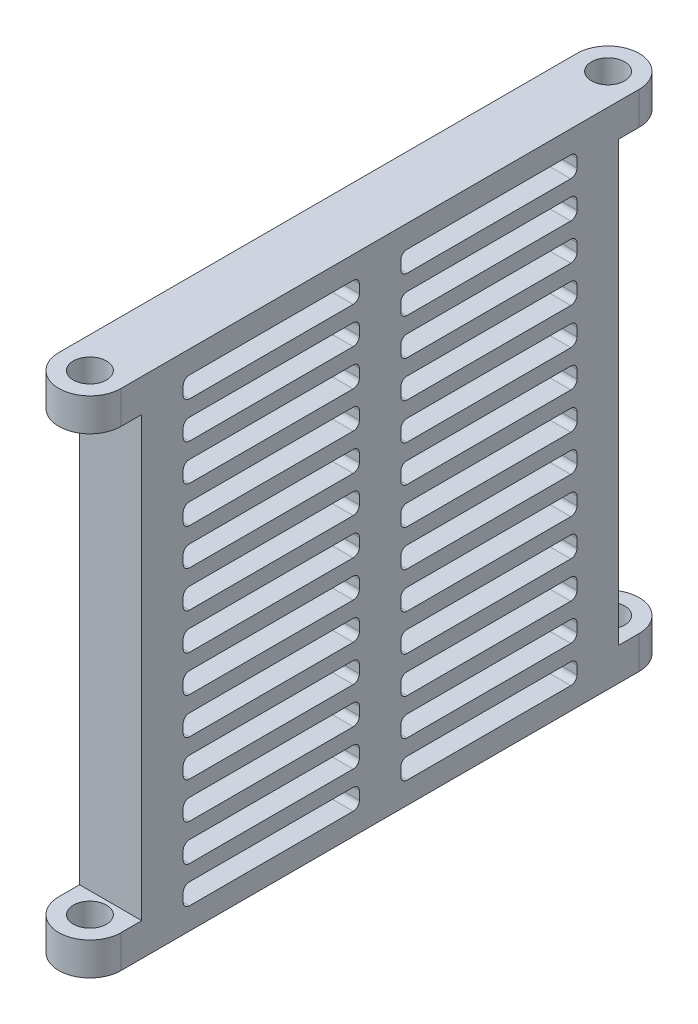
from build123d import *

# Parameters (mm, degrees)
SKETCH2_R           = 1.6
BOSS_EXTRUDE1_DEPTH = 3.175
SKETCH3_W           = 6
SKETCH3_H           = 46
BOSS_EXTRUDE2_DEPTH = 42.3
CUT_EXTRUDE1_DEPTH  = 73.192953257


with BuildPart() as part:
    # Sketch2 → Boss-Extrude1 (new body)
    with BuildSketch(Plane(origin=(0, 0, 0), x_dir=(1, 0, 0), z_dir=(0, 1, 0))):
        with BuildLine():
            Line((-3, 0), (-3, -50))
            ThreePointArc((-3, -50), (0, -53), (3, -50))
            Line((3, -50), (3, 0))
            ThreePointArc((3, 0), (0, 3), (-3, 0))
        make_face()
        Circle(SKETCH2_R, mode=Mode.SUBTRACT)
        with Locations((0, -50)):
            Circle(SKETCH2_R, mode=Mode.SUBTRACT)
    boss_extrude1 = extrude(amount=BOSS_EXTRUDE1_DEPTH)

    # Sketch3 → Boss-Extrude2 (add)
    with BuildSketch(Plane(origin=(0, 3.175, 0), x_dir=(1, 0, 0), z_dir=(0, 1, 0))):
        with Locations((0, -25)):
            Rectangle(SKETCH3_W, SKETCH3_H)
    extrude(amount=BOSS_EXTRUDE2_DEPTH)

    # Mirror2: Boss-Extrude1 across plane
    add(boss_extrude1.mirror(Plane.ZX.offset(24.325)))

    # Sketch4 → Cut-Extrude1 (cut, through all)
    with BuildSketch(Plane(origin=(3, 0, 0), x_dir=(0, 0, -1), z_dir=(1, 0, 0))):
        with BuildLine():
            Line((-6.6, 46.475), (-22.4, 46.475))
            ThreePointArc((-22.4, 46.475), (-22.824264069, 46.299264069), (-23, 45.875))
            Line((-23, 45.875), (-23, 45.075))
            ThreePointArc((-23, 45.075), (-22.824264069, 44.650735931), (-22.4, 44.475))
            Line((-22.4, 44.475), (-6.6, 44.475))
            ThreePointArc((-6.6, 44.475), (-6.175735931, 44.650735931), (-6, 45.075))
            Line((-6, 45.075), (-6, 45.875))
            ThreePointArc((-6, 45.875), (-6.175735931, 46.299264069), (-6.6, 46.475))
        make_face()
        with BuildLine():
            Line((-6.6, 42.945), (-22.4, 42.945))
            ThreePointArc((-22.4, 42.945), (-22.824264069, 42.769264069), (-23, 42.345))
            Line((-23, 42.345), (-23, 41.545))
            ThreePointArc((-23, 41.545), (-22.824264069, 41.120735931), (-22.4, 40.945))
            Line((-22.4, 40.945), (-6.6, 40.945))
            ThreePointArc((-6.6, 40.945), (-6.175735931, 41.120735931), (-6, 41.545))
            Line((-6, 41.545), (-6, 42.345))
            ThreePointArc((-6, 42.345), (-6.175735931, 42.769264069), (-6.6, 42.945))
        make_face()
        with BuildLine():
            Line((-6.6, 39.415), (-22.4, 39.415))
            ThreePointArc((-22.4, 39.415), (-22.824264069, 39.239264069), (-23, 38.815))
            Line((-23, 38.815), (-23, 38.015))
            ThreePointArc((-23, 38.015), (-22.824264069, 37.590735931), (-22.4, 37.415))
            Line((-22.4, 37.415), (-6.6, 37.415))
            ThreePointArc((-6.6, 37.415), (-6.175735931, 37.590735931), (-6, 38.015))
            Line((-6, 38.015), (-6, 38.815))
            ThreePointArc((-6, 38.815), (-6.175735931, 39.239264069), (-6.6, 39.415))
        make_face()
        with BuildLine():
            Line((-6.6, 35.885), (-22.4, 35.885))
            ThreePointArc((-22.4, 35.885), (-22.824264069, 35.709264069), (-23, 35.285))
            Line((-23, 35.285), (-23, 34.485))
            ThreePointArc((-23, 34.485), (-22.824264069, 34.060735931), (-22.4, 33.885))
            Line((-22.4, 33.885), (-6.6, 33.885))
            ThreePointArc((-6.6, 33.885), (-6.175735931, 34.060735931), (-6, 34.485))
            Line((-6, 34.485), (-6, 35.285))
            ThreePointArc((-6, 35.285), (-6.175735931, 35.709264069), (-6.6, 35.885))
        make_face()
        with BuildLine():
            Line((-6.6, 32.355), (-22.4, 32.355))
            ThreePointArc((-22.4, 32.355), (-22.824264069, 32.179264069), (-23, 31.755))
            Line((-23, 31.755), (-23, 30.955))
            ThreePointArc((-23, 30.955), (-22.824264069, 30.530735931), (-22.4, 30.355))
            Line((-22.4, 30.355), (-6.6, 30.355))
            ThreePointArc((-6.6, 30.355), (-6.175735931, 30.530735931), (-6, 30.955))
            Line((-6, 30.955), (-6, 31.755))
            ThreePointArc((-6, 31.755), (-6.175735931, 32.179264069), (-6.6, 32.355))
        make_face()
        with BuildLine():
            Line((-6.6, 28.825), (-22.4, 28.825))
            ThreePointArc((-22.4, 28.825), (-22.824264069, 28.649264069), (-23, 28.225))
            Line((-23, 28.225), (-23, 27.425))
            ThreePointArc((-23, 27.425), (-22.824264069, 27.000735931), (-22.4, 26.825))
            Line((-22.4, 26.825), (-6.6, 26.825))
            ThreePointArc((-6.6, 26.825), (-6.175735931, 27.000735931), (-6, 27.425))
            Line((-6, 27.425), (-6, 28.225))
            ThreePointArc((-6, 28.225), (-6.175735931, 28.649264069), (-6.6, 28.825))
        make_face()
        with BuildLine():
            Line((-6.6, 25.295), (-22.4, 25.295))
            ThreePointArc((-22.4, 25.295), (-22.824264069, 25.119264069), (-23, 24.695))
            Line((-23, 24.695), (-23, 23.895))
            ThreePointArc((-23, 23.895), (-22.824264069, 23.470735931), (-22.4, 23.295))
            Line((-22.4, 23.295), (-6.6, 23.295))
            ThreePointArc((-6.6, 23.295), (-6.175735931, 23.470735931), (-6, 23.895))
            Line((-6, 23.895), (-6, 24.695))
            ThreePointArc((-6, 24.695), (-6.175735931, 25.119264069), (-6.6, 25.295))
        make_face()
        with BuildLine():
            Line((-6.6, 21.765), (-22.4, 21.765))
            ThreePointArc((-22.4, 21.765), (-22.824264069, 21.589264069), (-23, 21.165))
            Line((-23, 21.165), (-23, 20.365))
            ThreePointArc((-23, 20.365), (-22.824264069, 19.940735931), (-22.4, 19.765))
            Line((-22.4, 19.765), (-6.6, 19.765))
            ThreePointArc((-6.6, 19.765), (-6.175735931, 19.940735931), (-6, 20.365))
            Line((-6, 20.365), (-6, 21.165))
            ThreePointArc((-6, 21.165), (-6.175735931, 21.589264069), (-6.6, 21.765))
        make_face()
        with BuildLine():
            Line((-6.6, 18.235), (-22.4, 18.235))
            ThreePointArc((-22.4, 18.235), (-22.824264069, 18.059264069), (-23, 17.635))
            Line((-23, 17.635), (-23, 16.835))
            ThreePointArc((-23, 16.835), (-22.824264069, 16.410735931), (-22.4, 16.235))
            Line((-22.4, 16.235), (-6.6, 16.235))
            ThreePointArc((-6.6, 16.235), (-6.175735931, 16.410735931), (-6, 16.835))
            Line((-6, 16.835), (-6, 17.635))
            ThreePointArc((-6, 17.635), (-6.175735931, 18.059264069), (-6.6, 18.235))
        make_face()
        with BuildLine():
            Line((-6.6, 14.705), (-22.4, 14.705))
            ThreePointArc((-22.4, 14.705), (-22.824264069, 14.529264069), (-23, 14.105))
            Line((-23, 14.105), (-23, 13.305))
            ThreePointArc((-23, 13.305), (-22.824264069, 12.880735931), (-22.4, 12.705))
            Line((-22.4, 12.705), (-6.6, 12.705))
            ThreePointArc((-6.6, 12.705), (-6.175735931, 12.880735931), (-6, 13.305))
            Line((-6, 13.305), (-6, 14.105))
            ThreePointArc((-6, 14.105), (-6.175735931, 14.529264069), (-6.6, 14.705))
        make_face()
        with BuildLine():
            Line((-6.6, 11.175), (-22.4, 11.175))
            ThreePointArc((-22.4, 11.175), (-22.824264069, 10.999264069), (-23, 10.575))
            Line((-23, 10.575), (-23, 9.775))
            ThreePointArc((-23, 9.775), (-22.824264069, 9.350735931), (-22.4, 9.175))
            Line((-22.4, 9.175), (-6.6, 9.175))
            ThreePointArc((-6.6, 9.175), (-6.175735931, 9.350735931), (-6, 9.775))
            Line((-6, 9.775), (-6, 10.575))
            ThreePointArc((-6, 10.575), (-6.175735931, 10.999264069), (-6.6, 11.175))
        make_face()
        with BuildLine():
            Line((-6.6, 7.645), (-22.4, 7.645))
            ThreePointArc((-22.4, 7.645), (-22.824264069, 7.469264069), (-23, 7.045))
            Line((-23, 7.045), (-23, 6.245))
            ThreePointArc((-23, 6.245), (-22.824264069, 5.820735931), (-22.4, 5.645))
            Line((-22.4, 5.645), (-6.6, 5.645))
            ThreePointArc((-6.6, 5.645), (-6.175735931, 5.820735931), (-6, 6.245))
            Line((-6, 6.245), (-6, 7.045))
            ThreePointArc((-6, 7.045), (-6.175735931, 7.469264069), (-6.6, 7.645))
        make_face()
        with BuildLine():
            Line((-6.6, 4.115), (-22.4, 4.115))
            ThreePointArc((-22.4, 4.115), (-22.824264069, 3.939264069), (-23, 3.515))
            Line((-23, 3.515), (-23, 2.715))
            ThreePointArc((-23, 2.715), (-22.824264069, 2.290735931), (-22.4, 2.115))
            Line((-22.4, 2.115), (-6.6, 2.115))
            ThreePointArc((-6.6, 2.115), (-6.175735931, 2.290735931), (-6, 2.715))
            Line((-6, 2.715), (-6, 3.515))
            ThreePointArc((-6, 3.515), (-6.175735931, 3.939264069), (-6.6, 4.115))
        make_face()
        with BuildLine():
            Line((-27, 3.515), (-27, 2.715))
            ThreePointArc((-27, 2.715), (-27.175735931, 2.290735931), (-27.6, 2.115))
            Line((-27.6, 2.115), (-43.4, 2.115))
            ThreePointArc((-43.4, 2.115), (-43.824264069, 2.290735931), (-44, 2.715))
            Line((-44, 2.715), (-44, 3.515))
            ThreePointArc((-44, 3.515), (-43.824264069, 3.939264069), (-43.4, 4.115))
            Line((-43.4, 4.115), (-27.6, 4.115))
            ThreePointArc((-27.6, 4.115), (-27.175735931, 3.939264069), (-27, 3.515))
        make_face()
        with BuildLine():
            Line((-27, 7.045), (-27, 6.245))
            ThreePointArc((-27, 6.245), (-27.175735931, 5.820735931), (-27.6, 5.645))
            Line((-27.6, 5.645), (-43.4, 5.645))
            ThreePointArc((-43.4, 5.645), (-43.824264069, 5.820735931), (-44, 6.245))
            Line((-44, 6.245), (-44, 7.045))
            ThreePointArc((-44, 7.045), (-43.824264069, 7.469264069), (-43.4, 7.645))
            Line((-43.4, 7.645), (-27.6, 7.645))
            ThreePointArc((-27.6, 7.645), (-27.175735931, 7.469264069), (-27, 7.045))
        make_face()
        with BuildLine():
            Line((-27, 10.575), (-27, 9.775))
            ThreePointArc((-27, 9.775), (-27.175735931, 9.350735931), (-27.6, 9.175))
            Line((-27.6, 9.175), (-43.4, 9.175))
            ThreePointArc((-43.4, 9.175), (-43.824264069, 9.350735931), (-44, 9.775))
            Line((-44, 9.775), (-44, 10.575))
            ThreePointArc((-44, 10.575), (-43.824264069, 10.999264069), (-43.4, 11.175))
            Line((-43.4, 11.175), (-27.6, 11.175))
            ThreePointArc((-27.6, 11.175), (-27.175735931, 10.999264069), (-27, 10.575))
        make_face()
        with BuildLine():
            Line((-27, 14.105), (-27, 13.305))
            ThreePointArc((-27, 13.305), (-27.175735931, 12.880735931), (-27.6, 12.705))
            Line((-27.6, 12.705), (-43.4, 12.705))
            ThreePointArc((-43.4, 12.705), (-43.824264069, 12.880735931), (-44, 13.305))
            Line((-44, 13.305), (-44, 14.105))
            ThreePointArc((-44, 14.105), (-43.824264069, 14.529264069), (-43.4, 14.705))
            Line((-43.4, 14.705), (-27.6, 14.705))
            ThreePointArc((-27.6, 14.705), (-27.175735931, 14.529264069), (-27, 14.105))
        make_face()
        with BuildLine():
            Line((-27, 17.635), (-27, 16.835))
            ThreePointArc((-27, 16.835), (-27.175735931, 16.410735931), (-27.6, 16.235))
            Line((-27.6, 16.235), (-43.4, 16.235))
            ThreePointArc((-43.4, 16.235), (-43.824264069, 16.410735931), (-44, 16.835))
            Line((-44, 16.835), (-44, 17.635))
            ThreePointArc((-44, 17.635), (-43.824264069, 18.059264069), (-43.4, 18.235))
            Line((-43.4, 18.235), (-27.6, 18.235))
            ThreePointArc((-27.6, 18.235), (-27.175735931, 18.059264069), (-27, 17.635))
        make_face()
        with BuildLine():
            Line((-27, 21.165), (-27, 20.365))
            ThreePointArc((-27, 20.365), (-27.175735931, 19.940735931), (-27.6, 19.765))
            Line((-27.6, 19.765), (-43.4, 19.765))
            ThreePointArc((-43.4, 19.765), (-43.824264069, 19.940735931), (-44, 20.365))
            Line((-44, 20.365), (-44, 21.165))
            ThreePointArc((-44, 21.165), (-43.824264069, 21.589264069), (-43.4, 21.765))
            Line((-43.4, 21.765), (-27.6, 21.765))
            ThreePointArc((-27.6, 21.765), (-27.175735931, 21.589264069), (-27, 21.165))
        make_face()
        with BuildLine():
            Line((-27, 24.695), (-27, 23.895))
            ThreePointArc((-27, 23.895), (-27.175735931, 23.470735931), (-27.6, 23.295))
            Line((-27.6, 23.295), (-43.4, 23.295))
            ThreePointArc((-43.4, 23.295), (-43.824264069, 23.470735931), (-44, 23.895))
            Line((-44, 23.895), (-44, 24.695))
            ThreePointArc((-44, 24.695), (-43.824264069, 25.119264069), (-43.4, 25.295))
            Line((-43.4, 25.295), (-27.6, 25.295))
            ThreePointArc((-27.6, 25.295), (-27.175735931, 25.119264069), (-27, 24.695))
        make_face()
        with BuildLine():
            Line((-27, 28.225), (-27, 27.425))
            ThreePointArc((-27, 27.425), (-27.175735931, 27.000735931), (-27.6, 26.825))
            Line((-27.6, 26.825), (-43.4, 26.825))
            ThreePointArc((-43.4, 26.825), (-43.824264069, 27.000735931), (-44, 27.425))
            Line((-44, 27.425), (-44, 28.225))
            ThreePointArc((-44, 28.225), (-43.824264069, 28.649264069), (-43.4, 28.825))
            Line((-43.4, 28.825), (-27.6, 28.825))
            ThreePointArc((-27.6, 28.825), (-27.175735931, 28.649264069), (-27, 28.225))
        make_face()
        with BuildLine():
            Line((-27, 31.755), (-27, 30.955))
            ThreePointArc((-27, 30.955), (-27.175735931, 30.530735931), (-27.6, 30.355))
            Line((-27.6, 30.355), (-43.4, 30.355))
            ThreePointArc((-43.4, 30.355), (-43.824264069, 30.530735931), (-44, 30.955))
            Line((-44, 30.955), (-44, 31.755))
            ThreePointArc((-44, 31.755), (-43.824264069, 32.179264069), (-43.4, 32.355))
            Line((-43.4, 32.355), (-27.6, 32.355))
            ThreePointArc((-27.6, 32.355), (-27.175735931, 32.179264069), (-27, 31.755))
        make_face()
        with BuildLine():
            Line((-27, 35.285), (-27, 34.485))
            ThreePointArc((-27, 34.485), (-27.175735931, 34.060735931), (-27.6, 33.885))
            Line((-27.6, 33.885), (-43.4, 33.885))
            ThreePointArc((-43.4, 33.885), (-43.824264069, 34.060735931), (-44, 34.485))
            Line((-44, 34.485), (-44, 35.285))
            ThreePointArc((-44, 35.285), (-43.824264069, 35.709264069), (-43.4, 35.885))
            Line((-43.4, 35.885), (-27.6, 35.885))
            ThreePointArc((-27.6, 35.885), (-27.175735931, 35.709264069), (-27, 35.285))
        make_face()
        with BuildLine():
            Line((-27, 38.815), (-27, 38.015))
            ThreePointArc((-27, 38.015), (-27.175735931, 37.590735931), (-27.6, 37.415))
            Line((-27.6, 37.415), (-43.4, 37.415))
            ThreePointArc((-43.4, 37.415), (-43.824264069, 37.590735931), (-44, 38.015))
            Line((-44, 38.015), (-44, 38.815))
            ThreePointArc((-44, 38.815), (-43.824264069, 39.239264069), (-43.4, 39.415))
            Line((-43.4, 39.415), (-27.6, 39.415))
            ThreePointArc((-27.6, 39.415), (-27.175735931, 39.239264069), (-27, 38.815))
        make_face()
        with BuildLine():
            Line((-27, 42.345), (-27, 41.545))
            ThreePointArc((-27, 41.545), (-27.175735931, 41.120735931), (-27.6, 40.945))
            Line((-27.6, 40.945), (-43.4, 40.945))
            ThreePointArc((-43.4, 40.945), (-43.824264069, 41.120735931), (-44, 41.545))
            Line((-44, 41.545), (-44, 42.345))
            ThreePointArc((-44, 42.345), (-43.824264069, 42.769264069), (-43.4, 42.945))
            Line((-43.4, 42.945), (-27.6, 42.945))
            ThreePointArc((-27.6, 42.945), (-27.175735931, 42.769264069), (-27, 42.345))
        make_face()
        with BuildLine():
            Line((-27, 45.875), (-27, 45.075))
            ThreePointArc((-27, 45.075), (-27.175735931, 44.650735931), (-27.6, 44.475))
            Line((-27.6, 44.475), (-43.4, 44.475))
            ThreePointArc((-43.4, 44.475), (-43.824264069, 44.650735931), (-44, 45.075))
            Line((-44, 45.075), (-44, 45.875))
            ThreePointArc((-44, 45.875), (-43.824264069, 46.299264069), (-43.4, 46.475))
            Line((-43.4, 46.475), (-27.6, 46.475))
            ThreePointArc((-27.6, 46.475), (-27.175735931, 46.299264069), (-27, 45.875))
        make_face()
    extrude(amount=-CUT_EXTRUDE1_DEPTH, mode=Mode.SUBTRACT)


solid = part.part
